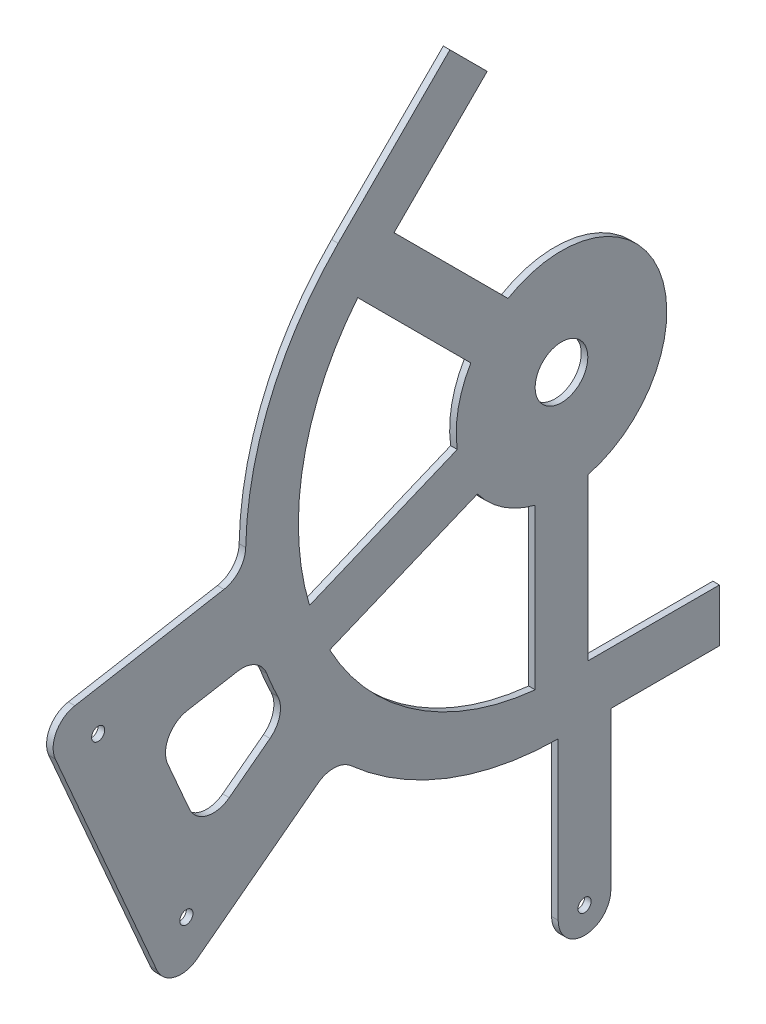
from build123d import *

# Parameters (mm, degrees)
BOSS_EXTRUDE2_DEPTH = 3.175
SKETCH11_W          = 76.2
SKETCH11_H          = 25.436159883
BOSS_EXTRUDE4_DEPTH = 3.175
SKETCH12_R          = 3.175
BOSS_EXTRUDE5_DEPTH = 3.175
SKETCH13_R          = 3.175
BOSS_EXTRUDE6_DEPTH = 3.175
SKETCH14_R          = 12.7
BOSS_EXTRUDE7_DEPTH = 3.175


with BuildPart() as part:
    # Sketch9 → Boss-Extrude2 (new body)
    with BuildSketch(Plane(origin=(0, 0, 0), x_dir=(0, 0, -1), z_dir=(1, 0, 0))):
        with BuildLine():
            Line((0, -126.954378983), (0, -152.390538866))
            ThreePointArc((0, -152.390538866), (-140.790499807, -58.317334473), (-107.756383421, 107.756383421))
            Line((-107.756383421, 107.756383421), (-53.840601545, 161.672165297))
            Line((-53.840601545, 161.672165297), (-35.854520405, 143.686084156))
            Line((-35.854520405, 143.686084156), (-89.770302281, 89.770302281))
            ThreePointArc((-89.770302281, 89.770302281), (-117.290552306, -48.583337503), (0, -126.954378983))
        make_face()
    extrude(amount=BOSS_EXTRUDE2_DEPTH)

    # Sketch11 → Boss-Extrude4 (add)
    with BuildSketch(Plane(origin=(0, 0, 0), x_dir=(0, 0, -1), z_dir=(1, 0, 0))):
        with Locations((38.1, -139.672458925)):
            Rectangle(SKETCH11_W, SKETCH11_H)
    extrude(amount=BOSS_EXTRUDE4_DEPTH)

    # Sketch12 → Boss-Extrude5 (add)
    with BuildSketch(Plane(origin=(0, 0, 0), x_dir=(0, 0, -1), z_dir=(1, 0, 0))):
        with BuildLine():
            ThreePointArc((-1.596710848, -228.181271676), (11.103289152, -240.881271676), (23.803289152, -228.181271676))
            Line((23.803289152, -228.181271676), (23.803289152, -152.390538866))
            Line((23.803289152, -152.390538866), (0, -152.390538866))
            ThreePointArc((0, -152.390538866), (-0.79836638, -152.388447551), (-1.596710848, -152.382173664))
            Line((-1.596710848, -152.382173664), (-1.596710848, -228.181271676))
        make_face()
        with Locations((11.103289152, -228.181271676)):
            Circle(SKETCH12_R, mode=Mode.SUBTRACT)
    extrude(amount=BOSS_EXTRUDE5_DEPTH)

    # Sketch13 → Boss-Extrude6 (add)
    with BuildSketch(Plane(origin=(0, 0, 0), x_dir=(0, 0, -1), z_dir=(1, 0, 0))):
        with BuildLine():
            Line((-175.921744047, -157.217647079), (-117.615441364, -113.032446562))
            ThreePointArc((-117.615441364, -113.032446562), (-109.43511183, -110.464604073), (-101.487144145, -113.680411283))
            ThreePointArc((-101.487144145, -113.680411283), (-121.45550521, -92.040407377), (-136.889329567, -66.964078331))
            ThreePointArc((-136.889329567, -66.964078331), (-135.942652679, -75.485545881), (-140.626971786, -82.666685125))
            Line((-140.626971786, -82.666685125), (-160.306949591, -97.58040329))
            ThreePointArc((-160.306949591, -97.58040329), (-171.19425961, -99.744336405), (-179.624122676, -92.522595986))
            Line((-179.624122676, -92.522595986), (-190.009209059, -68.638532465))
            ThreePointArc((-190.009209059, -68.638532465), (-189.548026602, -57.559851452), (-180.560256724, -51.066019389))
            Line((-180.560256724, -51.066019389), (-156.267984197, -46.797896728))
            ThreePointArc((-156.267984197, -46.797896728), (-147.818260582, -48.251780205), (-142.218034883, -54.744012368))
            ThreePointArc((-142.218034883, -54.744012368), (-150.091480412, -26.370890083), (-152.361266177, 2.986788389))
            ThreePointArc((-152.361266177, 2.986788389), (-155.413049284, -5.02559117), (-162.861116025, -9.272697026))
            Line((-162.861116025, -9.272697026), (-234.783717211, -21.90941035))
            ThreePointArc((-234.783717211, -21.90941035), (-243.771487088, -28.403242413), (-244.232669546, -39.481923426))
            Line((-244.232669546, -39.481923426), (-195.238917132, -152.159839775))
            ThreePointArc((-195.238917132, -152.159839775), (-186.809054067, -159.381580194), (-175.921744047, -157.217647079))
        make_face()
        with Locations((-180.989788445, -137.156185968)):
            Circle(SKETCH13_R, mode=Mode.SUBTRACT)
        with Locations((-223.548763187, -39.27724509)):
            Circle(SKETCH13_R, mode=Mode.SUBTRACT)
    extrude(amount=BOSS_EXTRUDE6_DEPTH)

    # Sketch14 → Boss-Extrude7 (add)
    with BuildSketch(Plane(origin=(0, 0, 0), x_dir=(0, 0, -1), z_dir=(1, 0, 0))):
        with BuildLine():
            Line((-25.800126281, 43.760638523), (-80.790046159, 98.750558402))
            Line((-80.790046159, 98.750558402), (-89.770302281, 89.770302281))
            ThreePointArc((-89.770302281, 89.770302281), (-94.153425206, 85.161886223), (-98.300254842, 80.3397426))
            Line((-98.300254842, 80.3397426), (-43.760638523, 25.800126281))
            ThreePointArc((-43.760638523, 25.800126281), (-49.823892244, 9.910588358), (-50.302839141, -7.089737254))
            Line((-50.302839141, -7.089737254), (-121.562281943, -36.60636491))
            ThreePointArc((-121.562281943, -36.60636491), (-117.290552306, -48.583337503), (-111.842122761, -60.072905036))
            Line((-111.842122761, -60.072905036), (-40.582679959, -30.55627738))
            ThreePointArc((-40.582679959, -30.55627738), (-28.222967837, -42.238656305), (-12.7, -49.186888497))
            Line((-12.7, -49.186888497), (-12.7, -126.317553583))
            ThreePointArc((-12.7, -126.317553583), (-6.357978189, -126.795072682), (0, -126.954378983))
            Line((0, -126.954378983), (12.7, -126.954378983))
            Line((12.7, -126.954378983), (12.7, -49.186888497))
            ThreePointArc((12.7, -49.186888497), (46.933080252, 19.440318364), (-25.800126281, 43.760638523))
        make_face()
        Circle(SKETCH14_R, mode=Mode.SUBTRACT)
    extrude(amount=BOSS_EXTRUDE7_DEPTH)


solid = part.part
